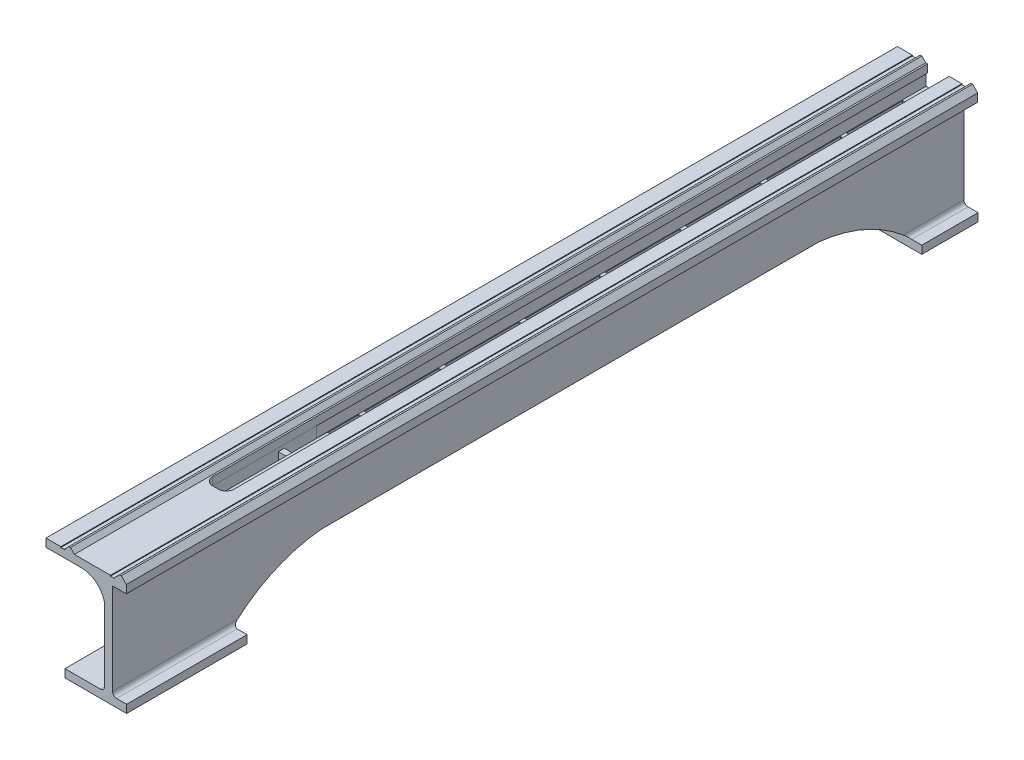
from build123d import *

# Parameters (mm, degrees)
BOSS_EXTRUDE1_DEPTH     = 1060
CUT_EXTRUDE1_DEPTH      = 800
SKETCH5_W               = 10.426623187
SKETCH5_H               = 125.292137731
BOSS_EXTRUDE2_DEPTH     = 950
SKETCH6_W               = 7.435137382
SKETCH6_H               = 64.029540506
BOSS_EXTRUDE3_DEPTH     = 50
LPATTERN1_COUNT         = 10
LPATTERN1_PITCH         = 100
CUT_EXTRUDE3_DEPTH      = 10
CUT_EXTRUDE3_DEPTH_BACK = 100
CUT_EXTRUDE2_START      = -300
SKETCH3_W               = 37.098457344
SKETCH3_H               = 15
CUT_EXTRUDE2_DEPTH      = 1000
SKETCH7_W               = 41.986295648
SKETCH7_H               = 14.210937294
BOSS_EXTRUDE4_DEPTH     = 30
SKETCH8_R               = 3.874254892
CUT_EXTRUDE4_DEPTH      = 30


with BuildPart() as part:
    # Sketch1 → Boss-Extrude1 (new body)
    with BuildSketch(Plane.XY):
        with BuildLine():
            Line((-31.555119126, 31.290150882), (-37.853807036, 37.718722311))
            Line((-37.853807036, 37.718722311), (-39.853807036, 37.718722311))
            Line((-39.853807036, 37.718722311), (-46.282378465, 31.420034401))
            Line((-46.282378465, 31.420034401), (-46.282378465, 30.420034401))
            Line((-46.282378465, 30.420034401), (-51.282378465, 30.420034401))
            Line((-51.282378465, 30.420034401), (-51.282378465, 31.420034401))
            Line((-51.282378465, 31.420034401), (-96.206307824, 31.420034401))
            Line((-96.206307824, 31.420034401), (-101.105287309, 36.420034401))
            Line((-101.105287309, 36.420034401), (-103.105287309, 36.420034401))
            Line((-103.105287309, 36.420034401), (-108.055034777, 31.470286932))
            Line((-108.055034777, 31.470286932), (-108.055034777, 30.420034401))
            Line((-108.055034777, 30.420034401), (-113.055034777, 30.420034401))
            Line((-113.055034777, 30.420034401), (-113.055034777, 31.420034401))
            Line((-113.055034777, 31.420034401), (-131.555034777, 31.420034401))
            Line((-131.555034777, 31.420034401), (-131.555034777, 21.420034401))
            Line((-131.555034777, 21.420034401), (-87.349569261, 21.420034401))
            ThreePointArc((-87.349569261, 21.420034401), (-68.862935324, 14.835575372), (-58.701074529, -1.95273366))
            Line((-58.701074529, -1.95273366), (-58.701074529, -92.579965599))
            ThreePointArc((-58.701074529, -92.579965599), (-60.165540623, -96.115499505), (-63.701074529, -97.579965599))
            Line((-63.701074529, -97.579965599), (-108.009983562, -97.579965599))
            Line((-108.009983562, -97.579965599), (-108.009983562, -107.579965599))
            Line((-108.009983562, -107.579965599), (-31.195424592, -107.579965599))
            Line((-31.195424592, -107.579965599), (-31.195424592, -97.579965599))
            Line((-31.195424592, -97.579965599), (-43.701074529, -97.579965599))
            ThreePointArc((-43.701074529, -97.579965599), (-47.236608435, -96.115499505), (-48.701074529, -92.579965599))
            Line((-48.701074529, -92.579965599), (-48.701074529, 21.290150882))
            Line((-48.701074529, 21.290150882), (-31.555119126, 21.290150882))
            Line((-31.555119126, 21.290150882), (-31.555119126, 31.290150882))
        make_face()
    extrude(amount=BOSS_EXTRUDE1_DEPTH)

    # Sketch2 → Cut-Extrude1 (cut)
    with BuildSketch(Plane(origin=(0, 20.764722339, 0), x_dir=(1, 0, 0), z_dir=(0, 1, 0))):
        with BuildLine():
            Line((-84.170689991, 100), (-77.170689991, 100))
            ThreePointArc((-77.170689991, 100), (-70.099622179, 97.071067812), (-67.170689991, 90))
            Line((-67.170689991, 90), (-67.170689991, -890))
            ThreePointArc((-67.170689991, -890), (-70.099622179, -897.071067812), (-77.170689991, -900))
            Line((-77.170689991, -900), (-84.170689991, -900))
            ThreePointArc((-84.170689991, -900), (-91.241757803, -897.071067812), (-94.170689991, -890))
            Line((-94.170689991, -890), (-94.170689991, 90))
            ThreePointArc((-94.170689991, 90), (-91.241757803, 97.071067812), (-84.170689991, 100))
        make_face()
    extrude(amount=CUT_EXTRUDE1_DEPTH, mode=Mode.SUBTRACT)

    # Sketch5 → Boss-Extrude2 (add)
    with BuildSketch(Plane(origin=(0, 0, 0), x_dir=(-1, 0, 0), z_dir=(0, 0, -1))):
        with Locations((100.133130522, -34.849417223)):
            Rectangle(SKETCH5_W, SKETCH5_H)
    extrude(amount=-BOSS_EXTRUDE2_DEPTH)

    # Sketch6 → Boss-Extrude3 (add)
    with BuildSketch(Plane.ZY.offset(105.346442115)):
        with Locations((3.717568691, -15.430068515)):
            Rectangle(SKETCH6_W, SKETCH6_H)
    boss_extrude3 = extrude(amount=-BOSS_EXTRUDE3_DEPTH)

    # LPattern1: Boss-Extrude3 ×10
    with Locations(*[(0, 0, i * LPATTERN1_PITCH) for i in range(1, LPATTERN1_COUNT)]):
        add(boss_extrude3)

    # Sketch4 → Cut-Extrude3 (cut, two sides: drawn at the far end of the back side and taken through both)
    with BuildSketch(Plane(origin=(-31.555119126, 0, 0), x_dir=(0, 0, -1), z_dir=(1, 0, 0)).offset(-CUT_EXTRUDE3_DEPTH_BACK)):
        with BuildLine():
            Line((-910, -97.579965599), (-910, -107.579965599))
            Line((-910, -107.579965599), (-910, -177.956634241))
            Line((-910, -177.956634241), (-70, -177.956634241))
            Line((-70, -177.956634241), (-70, -97.579965599))
            ThreePointArc((-70, -97.579965599), (-121.056751887, -63.823667059), (-180.068799532, -47.579965599))
            Line((-180.068799532, -47.579965599), (-800, -47.579965599))
            ThreePointArc((-800, -47.579965599), (-859.23910305, -63.253938888), (-910, -97.579965599))
        make_face()
    extrude(amount=CUT_EXTRUDE3_DEPTH + CUT_EXTRUDE3_DEPTH_BACK, mode=Mode.SUBTRACT)

    # Sketch3 → Cut-Extrude2 (cut)
    with BuildSketch(Plane.XY.offset(1060).offset(CUT_EXTRUDE2_START)):
        with Locations((-77.250303201, 13.920034401)):
            Rectangle(SKETCH3_W, SKETCH3_H)
    extrude(amount=-CUT_EXTRUDE2_DEPTH, mode=Mode.SUBTRACT)

    # Sketch7 → Boss-Extrude4 (add)
    with BuildSketch(Plane(origin=(0, 0, 0), x_dir=(-1, 0, 0), z_dir=(0, 0, -1))):
        with Locations((78.756733265, -0.685434246)):
            Rectangle(SKETCH7_W, SKETCH7_H)
    extrude(amount=-BOSS_EXTRUDE4_DEPTH)

    # Sketch8 → Cut-Extrude4 (cut)
    with BuildSketch(Plane(origin=(0, 6.420034401, 0), x_dir=(1, 0, 0), z_dir=(0, 1, 0))):
        with Locations((-79.789069173, -14.972288239)):
            Circle(SKETCH8_R)
    extrude(amount=-CUT_EXTRUDE4_DEPTH, mode=Mode.SUBTRACT)


solid = part.part
